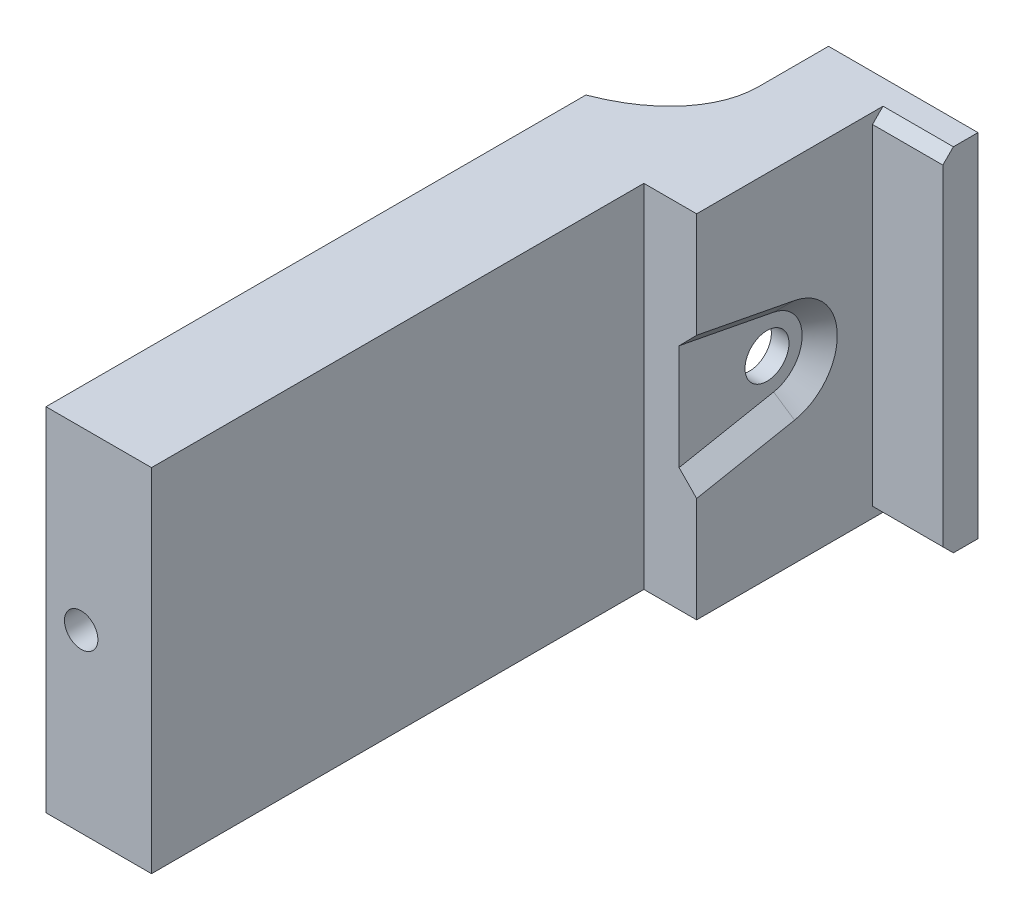
from build123d import *

# Parameters (mm, degrees)
EXTRUDE_1_DEPTH     = 10
SKETCH_2_R          = 1.25
CUT_EXTRUDE_1_DEPTH = 15
SKETCH_4_R          = 0.95
CUT_EXTRUDE_2_DEPTH = 40.749213829
EXTRUDE_2_DEPTH     = 28
SKETCH_7_W          = 6
SKETCH_7_H          = 20
EXTRUDE_4_DEPTH     = 2
CHAMFER_1_SIZE      = 0.6
EXTRUDE_5_DEPTH     = 10
FILLET_2_R          = 6
CUT_EXTRUDE_3_DEPTH = 1
CHAMFER_2_SIZE      = 1


# Some blends are built 0.0001 mm under size
with BuildPart() as part:
    # 草图1 → 凸台-拉伸1 (new, symmetric)
    with BuildSketch(Plane(origin=(0, 0, 0), x_dir=(1, 0, 0), z_dir=(0, 1, 0))):
        Polygon((0, 0), (3, 0), (3, 10), (1, 10), (1, 2), (-2, 2), (-2, -26), (-6, -26), (-6, -28), (0, -28), align=None)
    extrude(amount=EXTRUDE_1_DEPTH, both=True)

    # 草图2 → 切除-拉伸1 (cut)
    with BuildSketch(Plane.ZY.offset(-1)):
        with Locations((-5, 0)):
            Circle(SKETCH_2_R)
    extrude(amount=-CUT_EXTRUDE_1_DEPTH, mode=Mode.SUBTRACT)

    # 草图4 → 切除-拉伸2 (cut, through all)
    with BuildSketch(Plane.XY.offset(28)):
        with Locations((-4, 0)):
            Circle(SKETCH_4_R)
    extrude(amount=-CUT_EXTRUDE_2_DEPTH, mode=Mode.SUBTRACT)

    # 草图5 → 凸台-拉伸2 (add)
    with BuildSketch(Plane(origin=(0, 0, 26), x_dir=(-1, 0, 0), z_dir=(0, 0, -1))):
        Polygon((2, 10), (6, 10), (2, 6), align=None)
        Polygon((2, -6), (2, -10), (6, -10), align=None)
    extrude(amount=EXTRUDE_2_DEPTH)

    # 草图7 → 凸台-拉伸4 (add)
    with BuildSketch(Plane(origin=(0, 0, -10), x_dir=(-1, 0, 0), z_dir=(0, 0, -1))):
        with Locations((-4, 0)):
            Rectangle(SKETCH_7_W, SKETCH_7_H)
    extrude(amount=EXTRUDE_4_DEPTH)

    # 倒角1
    chamfer_1_edges = [part.edges().sort_by_distance(p)[0] for p in [
        (5, 10, -10),
        (5, -10, -10),
    ]]
    chamfer(chamfer_1_edges, length=CHAMFER_1_SIZE)

    # 草图8 → 凸台-拉伸5 (add)
    with BuildSketch(Plane(origin=(0, 0, -2), x_dir=(-1, 0, 0), z_dir=(0, 0, -1))):
        Polygon((-1, 10), (1.5, 10), (-1, 7.5), align=None)
        Polygon((-1, -7.5), (-1, -10), (1.5, -10), align=None)
    extrude(amount=EXTRUDE_5_DEPTH)

    # 圆角2
    # the kernel refuses this fillet: 6 mm, written as the material it adds along each edge
    with BuildSketch(Plane(origin=(-12.106601718, -20.606601718, -2), x_dir=(-0.7071067811865437, 0.7071067811865513, 0), z_dir=(0.7071067811865513, 0.7071067811865438, 0))) as fillet_2_piece_1_section:
        with BuildLine():
            CenterArc((FILLET_2_R, -FILLET_2_R), FILLET_2_R, 90, 90)
            Line((0, -FILLET_2_R), (0, 0))
            Line((0, 0), (FILLET_2_R, 0))
        make_face()
    fillet_2_piece_1 = extrude(amount=33.535533906, mode=Mode.PRIVATE)
    fillet_2_piece_1 = split(fillet_2_piece_1, bisect_by=Plane(origin=(-2, -8.855149606, -2.774001208), z_dir=(-1, 0, 0)), keep=Keep.TOP, mode=Mode.PRIVATE)
    fillet_2_piece_1 = split(fillet_2_piece_1, bisect_by=Plane(origin=(-4, -8, -2.774001208), z_dir=(0.7071067811865515, -0.7071067811865436, 0)), keep=Keep.TOP, mode=Mode.PRIVATE)
    fillet_2_piece_1 = split(fillet_2_piece_1, bisect_by=Plane(origin=(-3.144850394, -10, -2.774001208), z_dir=(0, 1, 0)), keep=Keep.TOP, mode=Mode.PRIVATE)
    add(fillet_2_piece_1)
    with BuildSketch(Plane(origin=(-12.106601718, -20.606601718, -2), x_dir=(-0.7071067811865437, 0.7071067811865513, 0), z_dir=(0.7071067811865513, 0.7071067811865438, 0))) as fillet_2_piece_2_section:
        with BuildLine():
            CenterArc((FILLET_2_R, -FILLET_2_R), FILLET_2_R, 90, 90)
            Line((0, -FILLET_2_R), (0, 0))
            Line((0, 0), (FILLET_2_R, 0))
        make_face()
    fillet_2_piece_2 = extrude(amount=33.535533906, mode=Mode.PRIVATE)
    fillet_2_piece_2 = split(fillet_2_piece_2, bisect_by=Plane(origin=(1, -3.168547951, -2.116110368), z_dir=(-1, 0, 0)), keep=Keep.TOP, mode=Mode.PRIVATE)
    fillet_2_piece_2 = split(fillet_2_piece_2, bisect_by=Plane(origin=(-2, -3.168547951, -2.116110368), z_dir=(1, 0, 0)), keep=Keep.TOP, mode=Mode.PRIVATE)
    fillet_2_piece_2 = split(fillet_2_piece_2, bisect_by=Plane(origin=(0.165726024, -3.834273976, -2.116110368), z_dir=(-0.7071067811865515, 0.7071067811865436, 0)), keep=Keep.TOP, mode=Mode.PRIVATE)
    add(fillet_2_piece_2)
    with BuildSketch(Plane(origin=(-12.106601718, -20.606601718, -2), x_dir=(-0.7071067811865437, 0.7071067811865513, 0), z_dir=(0.7071067811865513, 0.7071067811865438, 0))) as fillet_2_piece_3_section:
        with BuildLine():
            CenterArc((FILLET_2_R, -FILLET_2_R), FILLET_2_R, 90, 90)
            Line((0, -FILLET_2_R), (0, 0))
            Line((0, 0), (FILLET_2_R, 0))
        make_face()
    fillet_2_piece_3 = extrude(amount=33.535533906, mode=Mode.PRIVATE)
    fillet_2_piece_3 = split(fillet_2_piece_3, bisect_by=Plane(origin=(1, -7.448559775, -3.464262476), z_dir=(-1, 0, 0)), keep=Keep.TOP, mode=Mode.PRIVATE)
    fillet_2_piece_3 = split(fillet_2_piece_3, bisect_by=Plane(origin=(-2, -7.448559775, -3.464262476), z_dir=(1, 0, 0)), keep=Keep.TOP, mode=Mode.PRIVATE)
    fillet_2_piece_3 = split(fillet_2_piece_3, bisect_by=Plane(origin=(-1.950921276, -5.950921276, -3.464262476), z_dir=(0.7071067811865515, -0.7071067811865436, 0)), keep=Keep.TOP, mode=Mode.PRIVATE)
    fillet_2_piece_3 = split(fillet_2_piece_3, bisect_by=Plane(origin=(-0.453282777, -10, -3.464262476), z_dir=(0, 1, 0)), keep=Keep.TOP, mode=Mode.PRIVATE)
    add(fillet_2_piece_3)
    with BuildSketch(Plane(origin=(-12.106601718, 20.606601718, -2), x_dir=(-0.707106781186544, -0.7071067811865511, 0), z_dir=(0.7071067811865511, -0.7071067811865439, 0))) as fillet_2_piece_4_section:
        with BuildLine():
            CenterArc((FILLET_2_R, FILLET_2_R), FILLET_2_R, 180, 90)
            Line((0, FILLET_2_R), (0, 0))
            Line((0, 0), (FILLET_2_R, 0))
        make_face()
    fillet_2_piece_4 = extrude(amount=33.535533906, mode=Mode.PRIVATE)
    fillet_2_piece_4 = split(fillet_2_piece_4, bisect_by=Plane(origin=(-3.144850394, 10, -2.774001208), z_dir=(0, -1, 0)), keep=Keep.TOP, mode=Mode.PRIVATE)
    fillet_2_piece_4 = split(fillet_2_piece_4, bisect_by=Plane(origin=(-4, 8, -2.774001208), z_dir=(0.7071067811865515, 0.7071067811865436, 0)), keep=Keep.TOP, mode=Mode.PRIVATE)
    fillet_2_piece_4 = split(fillet_2_piece_4, bisect_by=Plane(origin=(-2, 8.855149606, -2.774001208), z_dir=(-1, 0, 0)), keep=Keep.TOP, mode=Mode.PRIVATE)
    add(fillet_2_piece_4)
    with BuildSketch(Plane(origin=(-12.106601718, 20.606601718, -2), x_dir=(-0.707106781186544, -0.7071067811865511, 0), z_dir=(0.7071067811865511, -0.7071067811865439, 0))) as fillet_2_piece_5_section:
        with BuildLine():
            CenterArc((FILLET_2_R, FILLET_2_R), FILLET_2_R, 180, 90)
            Line((0, FILLET_2_R), (0, 0))
            Line((0, 0), (FILLET_2_R, 0))
        make_face()
    fillet_2_piece_5 = extrude(amount=33.535533906, mode=Mode.PRIVATE)
    fillet_2_piece_5 = split(fillet_2_piece_5, bisect_by=Plane(origin=(1, 3.168547951, -2.116110368), z_dir=(-1, 0, 0)), keep=Keep.TOP, mode=Mode.PRIVATE)
    fillet_2_piece_5 = split(fillet_2_piece_5, bisect_by=Plane(origin=(0.165726024, 3.834273976, -2.116110368), z_dir=(-0.7071067811865515, -0.7071067811865436, 0)), keep=Keep.TOP, mode=Mode.PRIVATE)
    fillet_2_piece_5 = split(fillet_2_piece_5, bisect_by=Plane(origin=(-2, 3.168547951, -2.116110368), z_dir=(1, 0, 0)), keep=Keep.TOP, mode=Mode.PRIVATE)
    add(fillet_2_piece_5)
    with BuildSketch(Plane(origin=(-12.106601718, 20.606601718, -2), x_dir=(-0.707106781186544, -0.7071067811865511, 0), z_dir=(0.7071067811865511, -0.7071067811865439, 0))) as fillet_2_piece_6_section:
        with BuildLine():
            CenterArc((FILLET_2_R, FILLET_2_R), FILLET_2_R, 180, 90)
            Line((0, FILLET_2_R), (0, 0))
            Line((0, 0), (FILLET_2_R, 0))
        make_face()
    fillet_2_piece_6 = extrude(amount=33.535533906, mode=Mode.PRIVATE)
    fillet_2_piece_6 = split(fillet_2_piece_6, bisect_by=Plane(origin=(1, 7.448559775, -3.464262476), z_dir=(-1, 0, 0)), keep=Keep.TOP, mode=Mode.PRIVATE)
    fillet_2_piece_6 = split(fillet_2_piece_6, bisect_by=Plane(origin=(-0.453282777, 10, -3.464262476), z_dir=(0, -1, 0)), keep=Keep.TOP, mode=Mode.PRIVATE)
    fillet_2_piece_6 = split(fillet_2_piece_6, bisect_by=Plane(origin=(-1.950921276, 5.950921276, -3.464262476), z_dir=(0.7071067811865515, 0.7071067811865436, 0)), keep=Keep.TOP, mode=Mode.PRIVATE)
    fillet_2_piece_6 = split(fillet_2_piece_6, bisect_by=Plane(origin=(-2, 7.448559775, -3.464262476), z_dir=(1, 0, 0)), keep=Keep.TOP, mode=Mode.PRIVATE)
    add(fillet_2_piece_6)

    # 草图9 → 切除-拉伸3 (cut)
    with BuildSketch(Plane(origin=(3, 0, 0), x_dir=(0, 0, -1), z_dir=(1, 0, 0))):
        with BuildLine():
            Line((0, -3), (0, 3))
            Line((0, 3), (5.378333925, 1.963889875))
            ThreePointArc((5.378333925, 1.963889875), (7, 0), (5.378333925, -1.963889875))
            Line((5.378333925, -1.963889875), (0, -3))
        make_face()
    extrude(amount=-CUT_EXTRUDE_3_DEPTH, mode=Mode.SUBTRACT)

    # 倒角2
    chamfer_2_edges = [part.edges().sort_by_distance(p)[0] for p in [
        (3, -2.481944938, -2.689166963),
        (3, 0, -7),
        (3, 2.481944938, -2.689166963),
    ]]
    chamfer(chamfer_2_edges, length=CHAMFER_2_SIZE - 0.0001)  # a hair under: the kernel refuses the full size


solid = part.part
